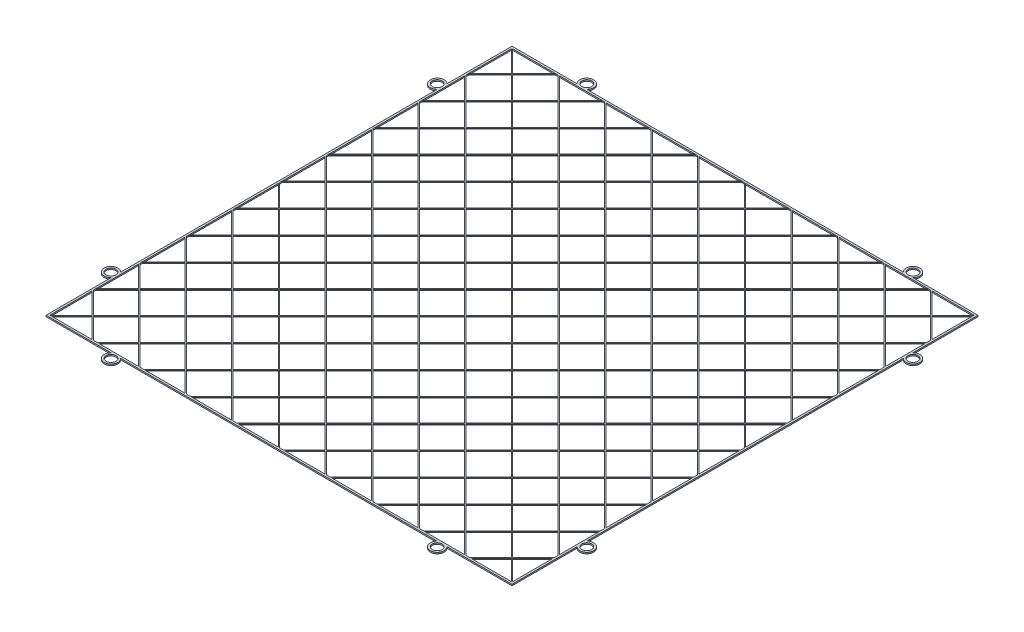
from build123d import *

# Parameters (mm, degrees)
SKETCH1_W                       = 190
SKETCH1_H                       = 190
SKETCH1_W_2                     = 188.4
SKETCH1_H_2                     = 188.4
BOSS_EXTRUDE1_DEPTH             = 0.28
BOSS_EXTRUDE4_REACH             = 136.351
SKETCH4_W                       = 0.4
SKETCH4_H                       = 0.28
BOSS_EXTRUDE4_DIRECTION_2_REACH = 136.351
LPATTERN4_COUNT                 = 10
LPATTERN4_PITCH                 = 13.435029
LPATTERN4_COL_COUNT             = 10
LPATTERN4_COL_PITCH             = 13.435029
BODY_MOVE_COPY2_ANGLE           = 180
SKETCH5_R                       = 2.8
SKETCH5_R_2                     = 2
BOSS_EXTRUDE5_DEPTH             = 0.28
CIRPATTERN1_COUNT               = 4
CIRPATTERN1_COPY_1_SKETCH_R     = 2.8
CIRPATTERN1_COPY_1_SKETCH_R_2   = 2
CIRPATTERN1_COPY_1_DEPTH        = 0.28
CIRPATTERN1_COPY_2_SKETCH_R     = 2.8
CIRPATTERN1_COPY_2_SKETCH_R_2   = 2
CIRPATTERN1_COPY_2_DEPTH        = 0.28
CIRPATTERN1_COPY_3_SKETCH_R     = 2.8
CIRPATTERN1_COPY_3_SKETCH_R_2   = 2
CIRPATTERN1_COPY_3_DEPTH        = 0.28


with BuildPart() as part:
    # Sketch1 → Boss-Extrude1 (new, symmetric)
    with BuildSketch(Plane(origin=(0, 0, 0), x_dir=(1, 0, 0), z_dir=(0, 1, 0))):
        Rectangle(SKETCH1_W, SKETCH1_H)
        Rectangle(SKETCH1_W_2, SKETCH1_H_2, mode=Mode.SUBTRACT)
    extrude(amount=BOSS_EXTRUDE1_DEPTH, both=True)

    # Sketch4 → Boss-Extrude4 (add, up to next)
    with BuildSketch(Plane(origin=(0, 0, 0), x_dir=(-0.7071067811865477, 0, -0.7071067811865475), z_dir=(0.7071067811865475, 0, -0.7071067811865477)), mode=Mode.PRIVATE) as boss_extrude4_sk1:
        with Locations((0, -0.14)):
            Rectangle(SKETCH4_W, SKETCH4_H)
    boss_extrude4_tool1 = extrude(boss_extrude4_sk1.sketch, amount=BOSS_EXTRUDE4_REACH, mode=Mode.PRIVATE) - part.part
    boss_extrude4 = boss_extrude4_tool1.solids().sort_by_distance((0, -0.14, 0))[0]
    add(boss_extrude4)

    # Sketch4 → Boss-Extrude4 direction 2 (add, up to next)
    with BuildSketch(Plane(origin=(0, 0, 0), x_dir=(-0.7071067811865477, 0, -0.7071067811865475), z_dir=(0.7071067811865475, 0, -0.7071067811865477)), mode=Mode.PRIVATE) as boss_extrude4_direction_2_sk1:
        with Locations((0, -0.14)):
            Rectangle(SKETCH4_W, SKETCH4_H)
    boss_extrude4_direction_2_tool1 = extrude(boss_extrude4_direction_2_sk1.sketch, amount=-BOSS_EXTRUDE4_DIRECTION_2_REACH, mode=Mode.PRIVATE) - part.part
    boss_extrude4_direction_2 = boss_extrude4_direction_2_tool1.solids().sort_by_distance((0, -0.14, 0))[0]
    add(boss_extrude4_direction_2)

    # LPattern4: Boss-Extrude4, Boss-Extrude4 direction 2; each copy of Boss-Extrude4, Boss-Extrude4 direction 2 runs up to whatever stops it at its own place
    lpattern4_before = part.part  # the part as the pattern finds it: every copy runs up to it
    lpattern4_boss_extrude4_long = extrude(boss_extrude4_sk1.sketch, amount=BOSS_EXTRUDE4_REACH, mode=Mode.PRIVATE)
    lpattern4_boss_extrude4_tool1 = lpattern4_boss_extrude4_long.moved(Location(Vector(-0.7071067811865477, 0, -0.7071067811865475) * (1 * LPATTERN4_PITCH))) - lpattern4_before
    add(lpattern4_boss_extrude4_tool1.solids().sort_by_distance((-9.5, -0.14, -9.5))[0])
    lpattern4_boss_extrude4_tool2 = lpattern4_boss_extrude4_long.moved(Location(Vector(-0.7071067811865477, 0, -0.7071067811865475) * (2 * LPATTERN4_PITCH))) - lpattern4_before
    add(lpattern4_boss_extrude4_tool2.solids().sort_by_distance((-19, -0.14, -19))[0])
    lpattern4_boss_extrude4_tool3 = lpattern4_boss_extrude4_long.moved(Location(Vector(-0.7071067811865477, 0, -0.7071067811865475) * (3 * LPATTERN4_PITCH))) - lpattern4_before
    add(lpattern4_boss_extrude4_tool3.solids().sort_by_distance((-28.5, -0.14, -28.5))[0])
    lpattern4_boss_extrude4_tool4 = lpattern4_boss_extrude4_long.moved(Location(Vector(-0.7071067811865477, 0, -0.7071067811865475) * (4 * LPATTERN4_PITCH))) - lpattern4_before
    add(lpattern4_boss_extrude4_tool4.solids().sort_by_distance((-38, -0.14, -38))[0])
    lpattern4_boss_extrude4_tool5 = lpattern4_boss_extrude4_long.moved(Location(Vector(-0.7071067811865477, 0, -0.7071067811865475) * (5 * LPATTERN4_PITCH))) - lpattern4_before
    add(lpattern4_boss_extrude4_tool5.solids().sort_by_distance((-47.500001, -0.14, -47.500001))[0])
    lpattern4_boss_extrude4_tool6 = lpattern4_boss_extrude4_long.moved(Location(Vector(-0.7071067811865477, 0, -0.7071067811865475) * (6 * LPATTERN4_PITCH))) - lpattern4_before
    add(lpattern4_boss_extrude4_tool6.solids().sort_by_distance((-57.000001, -0.14, -57.000001))[0])
    lpattern4_boss_extrude4_tool7 = lpattern4_boss_extrude4_long.moved(Location(Vector(-0.7071067811865477, 0, -0.7071067811865475) * (7 * LPATTERN4_PITCH))) - lpattern4_before
    add(lpattern4_boss_extrude4_tool7.solids().sort_by_distance((-66.500001, -0.14, -66.500001))[0])
    lpattern4_boss_extrude4_tool8 = lpattern4_boss_extrude4_long.moved(Location(Vector(-0.7071067811865477, 0, -0.7071067811865475) * (8 * LPATTERN4_PITCH))) - lpattern4_before
    add(lpattern4_boss_extrude4_tool8.solids().sort_by_distance((-76.000001, -0.14, -76.000001))[0])
    lpattern4_boss_extrude4_tool9 = lpattern4_boss_extrude4_long.moved(Location(Vector(-0.7071067811865477, 0, -0.7071067811865475) * (9 * LPATTERN4_PITCH))) - lpattern4_before
    add(lpattern4_boss_extrude4_tool9.solids().sort_by_distance((-85.500001, -0.14, -85.500001))[0])
    lpattern4_boss_extrude4_direction_2_long = extrude(boss_extrude4_direction_2_sk1.sketch, amount=-BOSS_EXTRUDE4_DIRECTION_2_REACH, mode=Mode.PRIVATE)
    lpattern4_boss_extrude4_direction_2_tool1 = lpattern4_boss_extrude4_direction_2_long.moved(Location(Vector(-0.7071067811865477, 0, -0.7071067811865475) * (1 * LPATTERN4_PITCH))) - lpattern4_before
    add(lpattern4_boss_extrude4_direction_2_tool1.solids().sort_by_distance((-9.5, -0.14, -9.5))[0])
    lpattern4_boss_extrude4_direction_2_tool2 = lpattern4_boss_extrude4_direction_2_long.moved(Location(Vector(-0.7071067811865477, 0, -0.7071067811865475) * (2 * LPATTERN4_PITCH))) - lpattern4_before
    add(lpattern4_boss_extrude4_direction_2_tool2.solids().sort_by_distance((-19, -0.14, -19))[0])
    lpattern4_boss_extrude4_direction_2_tool3 = lpattern4_boss_extrude4_direction_2_long.moved(Location(Vector(-0.7071067811865477, 0, -0.7071067811865475) * (3 * LPATTERN4_PITCH))) - lpattern4_before
    add(lpattern4_boss_extrude4_direction_2_tool3.solids().sort_by_distance((-28.5, -0.14, -28.5))[0])
    lpattern4_boss_extrude4_direction_2_tool4 = lpattern4_boss_extrude4_direction_2_long.moved(Location(Vector(-0.7071067811865477, 0, -0.7071067811865475) * (4 * LPATTERN4_PITCH))) - lpattern4_before
    add(lpattern4_boss_extrude4_direction_2_tool4.solids().sort_by_distance((-38, -0.14, -38))[0])
    lpattern4_boss_extrude4_direction_2_tool5 = lpattern4_boss_extrude4_direction_2_long.moved(Location(Vector(-0.7071067811865477, 0, -0.7071067811865475) * (5 * LPATTERN4_PITCH))) - lpattern4_before
    add(lpattern4_boss_extrude4_direction_2_tool5.solids().sort_by_distance((-47.500001, -0.14, -47.500001))[0])
    lpattern4_boss_extrude4_direction_2_tool6 = lpattern4_boss_extrude4_direction_2_long.moved(Location(Vector(-0.7071067811865477, 0, -0.7071067811865475) * (6 * LPATTERN4_PITCH))) - lpattern4_before
    add(lpattern4_boss_extrude4_direction_2_tool6.solids().sort_by_distance((-57.000001, -0.14, -57.000001))[0])
    lpattern4_boss_extrude4_direction_2_tool7 = lpattern4_boss_extrude4_direction_2_long.moved(Location(Vector(-0.7071067811865477, 0, -0.7071067811865475) * (7 * LPATTERN4_PITCH))) - lpattern4_before
    add(lpattern4_boss_extrude4_direction_2_tool7.solids().sort_by_distance((-66.500001, -0.14, -66.500001))[0])
    lpattern4_boss_extrude4_direction_2_tool8 = lpattern4_boss_extrude4_direction_2_long.moved(Location(Vector(-0.7071067811865477, 0, -0.7071067811865475) * (8 * LPATTERN4_PITCH))) - lpattern4_before
    add(lpattern4_boss_extrude4_direction_2_tool8.solids().sort_by_distance((-76.000001, -0.14, -76.000001))[0])
    lpattern4_boss_extrude4_direction_2_tool9 = lpattern4_boss_extrude4_direction_2_long.moved(Location(Vector(-0.7071067811865477, 0, -0.7071067811865475) * (9 * LPATTERN4_PITCH))) - lpattern4_before
    add(lpattern4_boss_extrude4_direction_2_tool9.solids().sort_by_distance((-85.500001, -0.14, -85.500001))[0])

    # LPattern4 col: Boss-Extrude4, Boss-Extrude4 direction 2; each copy of Boss-Extrude4, Boss-Extrude4 direction 2 runs up to whatever stops it at its own place
    lpattern4_col_before = part.part  # the part as the pattern finds it: every copy runs up to it
    lpattern4_col_boss_extrude4_long = extrude(boss_extrude4_sk1.sketch, amount=BOSS_EXTRUDE4_REACH, mode=Mode.PRIVATE)
    lpattern4_col_boss_extrude4_tool1 = lpattern4_col_boss_extrude4_long.moved(Location(Vector(0.7071067811865477, 0, 0.7071067811865475) * (1 * LPATTERN4_COL_PITCH))) - lpattern4_col_before
    add(lpattern4_col_boss_extrude4_tool1.solids().sort_by_distance((9.5, -0.14, 9.5))[0])
    lpattern4_col_boss_extrude4_tool2 = lpattern4_col_boss_extrude4_long.moved(Location(Vector(0.7071067811865477, 0, 0.7071067811865475) * (2 * LPATTERN4_COL_PITCH))) - lpattern4_col_before
    add(lpattern4_col_boss_extrude4_tool2.solids().sort_by_distance((19, -0.14, 19))[0])
    lpattern4_col_boss_extrude4_tool3 = lpattern4_col_boss_extrude4_long.moved(Location(Vector(0.7071067811865477, 0, 0.7071067811865475) * (3 * LPATTERN4_COL_PITCH))) - lpattern4_col_before
    add(lpattern4_col_boss_extrude4_tool3.solids().sort_by_distance((28.5, -0.14, 28.5))[0])
    lpattern4_col_boss_extrude4_tool4 = lpattern4_col_boss_extrude4_long.moved(Location(Vector(0.7071067811865477, 0, 0.7071067811865475) * (4 * LPATTERN4_COL_PITCH))) - lpattern4_col_before
    add(lpattern4_col_boss_extrude4_tool4.solids().sort_by_distance((38, -0.14, 38))[0])
    lpattern4_col_boss_extrude4_tool5 = lpattern4_col_boss_extrude4_long.moved(Location(Vector(0.7071067811865477, 0, 0.7071067811865475) * (5 * LPATTERN4_COL_PITCH))) - lpattern4_col_before
    add(lpattern4_col_boss_extrude4_tool5.solids().sort_by_distance((47.500001, -0.14, 47.500001))[0])
    lpattern4_col_boss_extrude4_tool6 = lpattern4_col_boss_extrude4_long.moved(Location(Vector(0.7071067811865477, 0, 0.7071067811865475) * (6 * LPATTERN4_COL_PITCH))) - lpattern4_col_before
    add(lpattern4_col_boss_extrude4_tool6.solids().sort_by_distance((57.000001, -0.14, 57.000001))[0])
    lpattern4_col_boss_extrude4_tool7 = lpattern4_col_boss_extrude4_long.moved(Location(Vector(0.7071067811865477, 0, 0.7071067811865475) * (7 * LPATTERN4_COL_PITCH))) - lpattern4_col_before
    add(lpattern4_col_boss_extrude4_tool7.solids().sort_by_distance((66.500001, -0.14, 66.500001))[0])
    lpattern4_col_boss_extrude4_tool8 = lpattern4_col_boss_extrude4_long.moved(Location(Vector(0.7071067811865477, 0, 0.7071067811865475) * (8 * LPATTERN4_COL_PITCH))) - lpattern4_col_before
    add(lpattern4_col_boss_extrude4_tool8.solids().sort_by_distance((76.000001, -0.14, 76.000001))[0])
    lpattern4_col_boss_extrude4_tool9 = lpattern4_col_boss_extrude4_long.moved(Location(Vector(0.7071067811865477, 0, 0.7071067811865475) * (9 * LPATTERN4_COL_PITCH))) - lpattern4_col_before
    add(lpattern4_col_boss_extrude4_tool9.solids().sort_by_distance((85.500001, -0.14, 85.500001))[0])
    lpattern4_col_boss_extrude4_direction_2_long = extrude(boss_extrude4_direction_2_sk1.sketch, amount=-BOSS_EXTRUDE4_DIRECTION_2_REACH, mode=Mode.PRIVATE)
    lpattern4_col_boss_extrude4_direction_2_tool1 = lpattern4_col_boss_extrude4_direction_2_long.moved(Location(Vector(0.7071067811865477, 0, 0.7071067811865475) * (1 * LPATTERN4_COL_PITCH))) - lpattern4_col_before
    add(lpattern4_col_boss_extrude4_direction_2_tool1.solids().sort_by_distance((9.5, -0.14, 9.5))[0])
    lpattern4_col_boss_extrude4_direction_2_tool2 = lpattern4_col_boss_extrude4_direction_2_long.moved(Location(Vector(0.7071067811865477, 0, 0.7071067811865475) * (2 * LPATTERN4_COL_PITCH))) - lpattern4_col_before
    add(lpattern4_col_boss_extrude4_direction_2_tool2.solids().sort_by_distance((19, -0.14, 19))[0])
    lpattern4_col_boss_extrude4_direction_2_tool3 = lpattern4_col_boss_extrude4_direction_2_long.moved(Location(Vector(0.7071067811865477, 0, 0.7071067811865475) * (3 * LPATTERN4_COL_PITCH))) - lpattern4_col_before
    add(lpattern4_col_boss_extrude4_direction_2_tool3.solids().sort_by_distance((28.5, -0.14, 28.5))[0])
    lpattern4_col_boss_extrude4_direction_2_tool4 = lpattern4_col_boss_extrude4_direction_2_long.moved(Location(Vector(0.7071067811865477, 0, 0.7071067811865475) * (4 * LPATTERN4_COL_PITCH))) - lpattern4_col_before
    add(lpattern4_col_boss_extrude4_direction_2_tool4.solids().sort_by_distance((38, -0.14, 38))[0])
    lpattern4_col_boss_extrude4_direction_2_tool5 = lpattern4_col_boss_extrude4_direction_2_long.moved(Location(Vector(0.7071067811865477, 0, 0.7071067811865475) * (5 * LPATTERN4_COL_PITCH))) - lpattern4_col_before
    add(lpattern4_col_boss_extrude4_direction_2_tool5.solids().sort_by_distance((47.500001, -0.14, 47.500001))[0])
    lpattern4_col_boss_extrude4_direction_2_tool6 = lpattern4_col_boss_extrude4_direction_2_long.moved(Location(Vector(0.7071067811865477, 0, 0.7071067811865475) * (6 * LPATTERN4_COL_PITCH))) - lpattern4_col_before
    add(lpattern4_col_boss_extrude4_direction_2_tool6.solids().sort_by_distance((57.000001, -0.14, 57.000001))[0])
    lpattern4_col_boss_extrude4_direction_2_tool7 = lpattern4_col_boss_extrude4_direction_2_long.moved(Location(Vector(0.7071067811865477, 0, 0.7071067811865475) * (7 * LPATTERN4_COL_PITCH))) - lpattern4_col_before
    add(lpattern4_col_boss_extrude4_direction_2_tool7.solids().sort_by_distance((66.500001, -0.14, 66.500001))[0])
    lpattern4_col_boss_extrude4_direction_2_tool8 = lpattern4_col_boss_extrude4_direction_2_long.moved(Location(Vector(0.7071067811865477, 0, 0.7071067811865475) * (8 * LPATTERN4_COL_PITCH))) - lpattern4_col_before
    add(lpattern4_col_boss_extrude4_direction_2_tool8.solids().sort_by_distance((76.000001, -0.14, 76.000001))[0])
    lpattern4_col_boss_extrude4_direction_2_tool9 = lpattern4_col_boss_extrude4_direction_2_long.moved(Location(Vector(0.7071067811865477, 0, 0.7071067811865475) * (9 * LPATTERN4_COL_PITCH))) - lpattern4_col_before
    add(lpattern4_col_boss_extrude4_direction_2_tool9.solids().sort_by_distance((85.500001, -0.14, 85.500001))[0])


with BuildPart() as body_2:
    # Body-Move/Copy2: copy of part
    add(part.part.rotate(Axis((0, 0, 0), (0, 0, 1)), BODY_MOVE_COPY2_ANGLE))


with BuildPart() as part_1:
    add(part.part)

    add(body_2.part)  # Boss-Extrude5 merges body 2
    # Sketch5 → Boss-Extrude5 (add, symmetric)
    with BuildSketch(Plane(origin=(0, 0, 0), x_dir=(1, 0, 0), z_dir=(0, 1, 0))):
        with Locations((-66.500000779, 97)):
            Circle(SKETCH5_R)
        with Locations(Location((-66.500000779, 97, 0), (0, 0, 270))):
            Circle(SKETCH5_R_2, mode=Mode.SUBTRACT)
    boss_extrude5 = extrude(amount=BOSS_EXTRUDE5_DEPTH, both=True)

    # Mirror2: Boss-Extrude5 across plane
    add(boss_extrude5.mirror(Plane(origin=(0, 0, 0), x_dir=(0, 0, 1), z_dir=(1, 0, 0))))

    # CirPattern1: Boss-Extrude5 ×4 about axis
    cirpattern1_axis = Axis((0, 0, 0), (0, 1, 0))
    for i in range(1, CIRPATTERN1_COUNT):
        add(boss_extrude5.rotate(cirpattern1_axis, i * 360 / CIRPATTERN1_COUNT))

    # CirPattern1 copy 1 sketch → CirPattern1 copy 1 (add, symmetric)
    with BuildSketch(Plane.ZX):
        with Locations((-66.500000779, -97)):
            Circle(CIRPATTERN1_COPY_1_SKETCH_R)
        with Locations((-66.500000779, -97)):
            Circle(CIRPATTERN1_COPY_1_SKETCH_R_2, mode=Mode.SUBTRACT)
    extrude(amount=CIRPATTERN1_COPY_1_DEPTH, both=True)

    # CirPattern1 copy 2 sketch → CirPattern1 copy 2 (add, symmetric)
    with BuildSketch(Plane(origin=(0, 0, 0), x_dir=(1, 0, 0), z_dir=(0, 1, 0))):
        with Locations((-66.500000779, -97)):
            Circle(CIRPATTERN1_COPY_2_SKETCH_R)
        with Locations((-66.500000779, -97)):
            Circle(CIRPATTERN1_COPY_2_SKETCH_R_2, mode=Mode.SUBTRACT)
    extrude(amount=CIRPATTERN1_COPY_2_DEPTH, both=True)

    # CirPattern1 copy 3 sketch → CirPattern1 copy 3 (add, symmetric)
    with BuildSketch(Plane(origin=(0, 0, 0), x_dir=(0, 0, -1), z_dir=(0, 1, 0))):
        with Locations((-66.500000779, -97)):
            Circle(CIRPATTERN1_COPY_3_SKETCH_R)
        with Locations((-66.500000779, -97)):
            Circle(CIRPATTERN1_COPY_3_SKETCH_R_2, mode=Mode.SUBTRACT)
    extrude(amount=CIRPATTERN1_COPY_3_DEPTH, both=True)


solid = part_1.part
